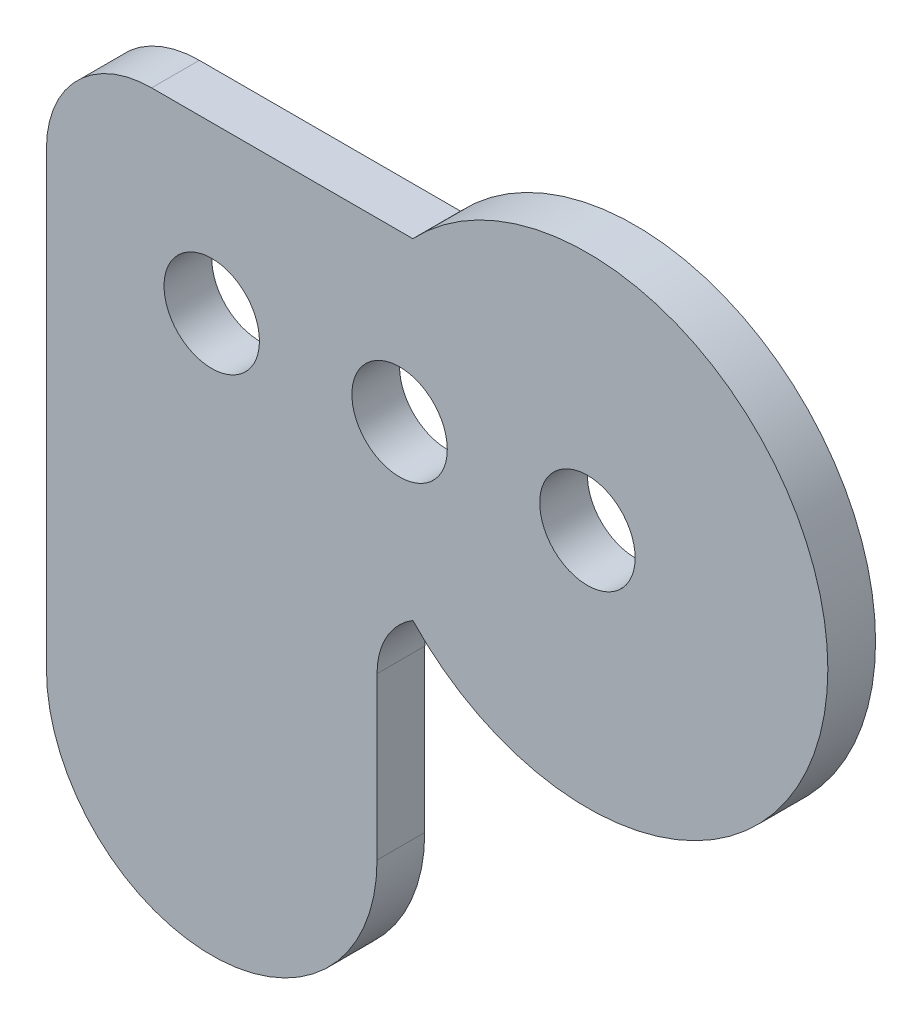
from build123d import *

# Parameters (mm, degrees)
BOSS_EXTRUDE1_DEPTH = 3.175
FILLET1_R           = 7
FILLET2_R           = 5
SKETCH2_R           = 3.175
CUT_EXTRUDE1_DEPTH  = 52.721181589
LPATTERN1_COUNT     = 3
LPATTERN1_PITCH     = 12.5


with BuildPart() as part:
    # Sketch1 → Boss-Extrude1 (new body)
    with BuildSketch(Plane.XY):
        with BuildLine():
            Line((-11.618950039, 11), (-36, 11))
            Line((-36, 11), (-36, -26))
            ThreePointArc((-36, -26), (-25, -37), (-14, -26))
            Line((-14, -26), (-14, -11))
            Line((-14, -11), (-11.618950039, -11))
            ThreePointArc((-11.618950039, -11), (16, 0), (-11.618950039, 11))
        make_face()
    extrude(amount=BOSS_EXTRUDE1_DEPTH)

    # Fillet1
    fillet1_edges = [part.edges().sort_by_distance(p)[0] for p in [
        (-36, 11, 1.5875),
    ]]
    fillet(fillet1_edges, radius=FILLET1_R)

    # Fillet2
    # the kernel refuses this fillet: 5 mm, written as the material it adds along each edge
    with BuildSketch(Plane(origin=(-14, -11, 0), x_dir=(1, 0, 0), z_dir=(0, 0, 1))) as fillet2_piece_1:
        with BuildLine():
            CenterArc((5, -4.259237102), FILLET2_R, 121.586822832, 58.413177168)
            Line((0, -4.259237102), (-0.1, -4.259237102))
            Line((-0.1, -4.259237102), (-0.1, 0))
            Line((-0.1, 0), (0, 0.1))
            ThreePointArc((0, 0.1), (1.190524981, 0.1), (2.328670961, 0.085184742))
            Line((2.328670961, 0.085184742), (2.381049961, 0))
        make_face()
    extrude(amount=3.175)

    # Sketch2 → Cut-Extrude1 (cut, through all)
    with BuildSketch(Plane.XY.offset(3.175)):
        Circle(SKETCH2_R)
    cut_extrude1 = extrude(amount=-CUT_EXTRUDE1_DEPTH, mode=Mode.SUBTRACT)

    # LPattern1: Cut-Extrude1 ×3
    with Locations(*[(-i * LPATTERN1_PITCH, 0, 0) for i in range(1, LPATTERN1_COUNT)]):
        add(cut_extrude1, mode=Mode.SUBTRACT)


solid = part.part
